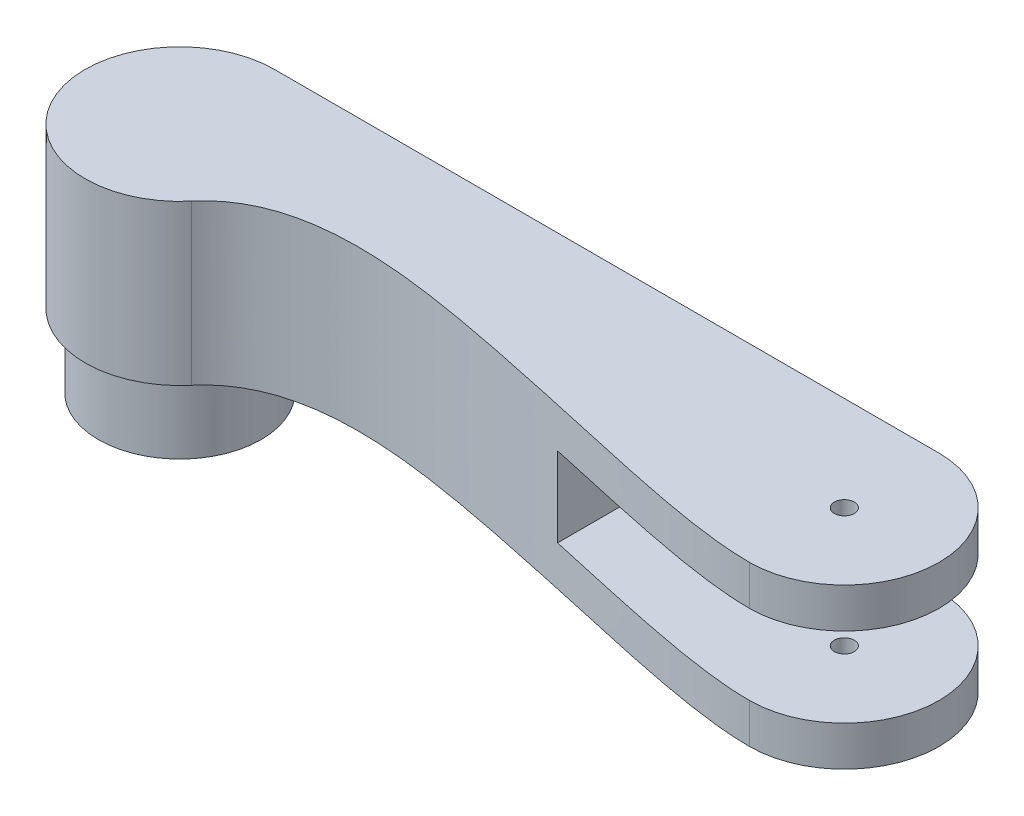
from build123d import *

# Parameters (mm, degrees)
BOSS_EXTRUDE1_DEPTH = 6
SKETCH3_R           = 1.5
CUT_EXTRUDE2_DEPTH  = 67.08422656
BOSS_EXTRUDE2_DEPTH = 12
BOSS_EXTRUDE3_DEPTH = 6
CUT_EXTRUDE3_REACH  = 72.051
SKETCH6_R           = 1.5
CUT_EXTRUDE4_REACH  = 72.051
SKETCH8_R           = 12.25
BOSS_EXTRUDE4_DEPTH = 11
SKETCH9_R           = 2.5
SKETCH9_R_2         = 3
CUT_EXTRUDE5_DEPTH  = 6


with BuildPart() as part:
    # Sketch1 → Boss-Extrude1 (new body)
    with BuildSketch(Plane(origin=(0, 0, 0), x_dir=(1, 0, 0), z_dir=(0, 1, 0))):
        with BuildLine():
            Line((-50, 14.25), (50, 14.25))
            ThreePointArc((50, 14.25), (64.25, 0), (50, -14.25))
            Line((50, -14.25), (-50, -14.25))
            ThreePointArc((-50, -14.25), (-64.25, 0), (-50, 14.25))
        make_face()
    extrude(amount=BOSS_EXTRUDE1_DEPTH)

    # Sketch3 → Cut-Extrude2 (cut, through all)
    with BuildSketch(Plane.XZ):
        with Locations((50, 0)):
            Circle(SKETCH3_R)
    extrude(amount=-CUT_EXTRUDE2_DEPTH, mode=Mode.SUBTRACT)

    # Sketch4 → Boss-Extrude2 (add)
    with BuildSketch(Plane(origin=(0, 6, 0), x_dir=(1, 0, 0), z_dir=(0, 1, 0))):
        with BuildLine():
            Line((-50, 14.25), (15, 14.25))
            Line((15, 14.25), (15, -14.25))
            Line((15, -14.25), (-50, -14.25))
            ThreePointArc((-50, -14.25), (-64.25, 0), (-50, 14.25))
        make_face()
    extrude(amount=BOSS_EXTRUDE2_DEPTH)

    # Sketch5 → Boss-Extrude3 (add)
    with BuildSketch(Plane(origin=(0, 18, 0), x_dir=(1, 0, 0), z_dir=(0, 1, 0))):
        with BuildLine():
            Line((-50, 14.25), (50, 14.25))
            ThreePointArc((50, 14.25), (64.25, 0), (50, -14.25))
            Line((50, -14.25), (-50, -14.25))
            ThreePointArc((-50, -14.25), (-64.25, 0), (-50, 14.25))
        make_face()
    extrude(amount=BOSS_EXTRUDE3_DEPTH)

    # Sketch6 → Cut-Extrude3 (cut, up to next)
    with BuildSketch(Plane(origin=(0, 24, 0), x_dir=(1, 0, 0), z_dir=(0, 1, 0)), mode=Mode.PRIVATE) as cut_extrude3_sk1:
        with Locations((50, 0)):
            Circle(SKETCH6_R)
    cut_extrude3_tool1 = extrude(cut_extrude3_sk1.sketch, amount=-CUT_EXTRUDE3_REACH, mode=Mode.PRIVATE) & part.part
    add(cut_extrude3_tool1.solids().sort_by_distance((50, 24, 0))[0], mode=Mode.SUBTRACT)

    # Sketch7 → Cut-Extrude4 (cut, up to next)
    with BuildSketch(Plane(origin=(0, 24, 0), x_dir=(1, 0, 0), z_dir=(0, 1, 0)), mode=Mode.PRIVATE) as cut_extrude4_sk1:
        with BuildLine():
            ThreePointArc((-39.07315683, -9.146944754), (-43.970135273, -12.911360555), (-50, -14.25))
            Line((-50, -14.25), (50, -14.25))
            add(Edge.make_bspline(
                [(-39.07315683, -9.146944754), (-31.514094033, -0.116968526), (5.438655837, -4.645240543), (38.697514387, -14.25), (50, -14.25)],
                knots=[0, 0, 0, 0, 0.435907903, 1, 1, 1, 1], degree=3))
        make_face()
    cut_extrude4_tool1 = extrude(cut_extrude4_sk1.sketch, amount=-CUT_EXTRUDE4_REACH, mode=Mode.PRIVATE) & part.part
    add(cut_extrude4_tool1.solids().sort_by_distance((-8.590717, 24, 9.791359))[0], mode=Mode.SUBTRACT)

    # Sketch8 → Boss-Extrude4 (add)
    with BuildSketch(Plane.XZ):
        with Locations((-50, 0)):
            Circle(SKETCH8_R)
    extrude(amount=BOSS_EXTRUDE4_DEPTH)

    # Sketch9 → Cut-Extrude5 (cut)
    with BuildSketch(Plane.XZ.offset(11)):
        with Locations((-50, 8.25)):
            Circle(SKETCH9_R)
        with Locations((-50, -8.25)):
            Circle(SKETCH9_R)
        with Locations((-50, 0)):
            Circle(SKETCH9_R_2)
    extrude(amount=-CUT_EXTRUDE5_DEPTH, mode=Mode.SUBTRACT)


solid = part.part
